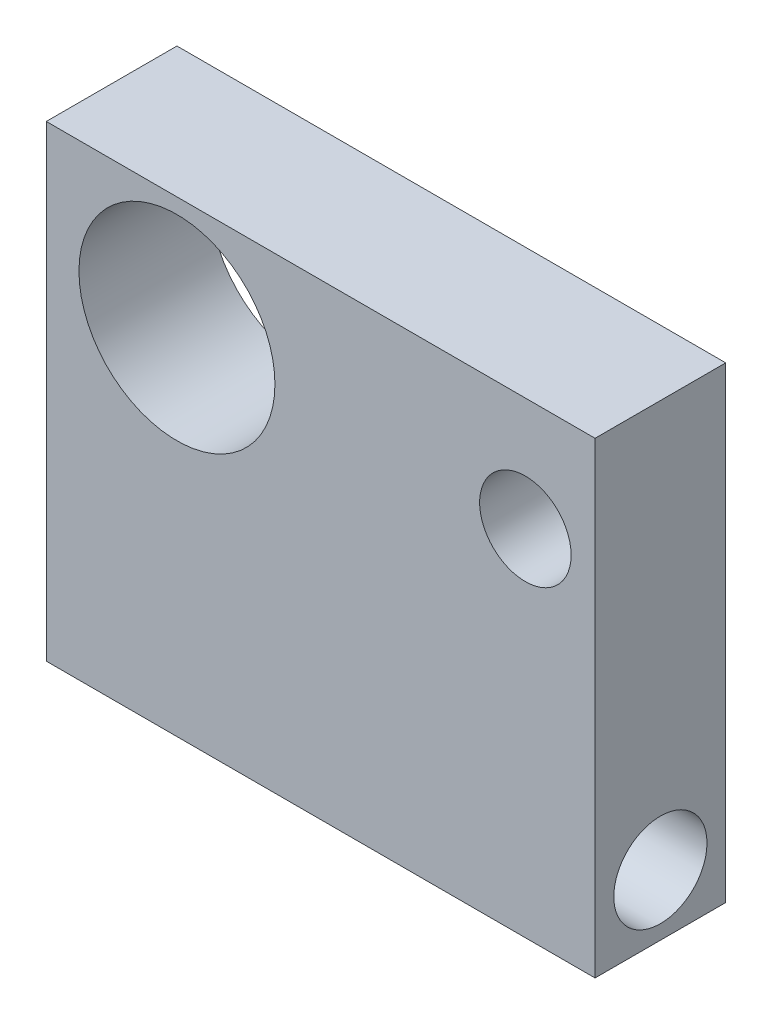
from build123d import *

# Parameters (mm, degrees)
SKETCH2_W           = 63
SKETCH2_H           = 53.66
SKETCH2_R           = 5.25
SKETCH2_R_2         = 11.25
BOSS_EXTRUDE1_DEPTH = 15
SKETCH3_R           = 5.35
CUT_EXTRUDE1_DEPTH  = 20
HOLE2_D             = 8.5


with BuildPart() as part:
    # Sketch2 → Boss-Extrude1 (new body)
    with BuildSketch(Plane.XY):
        with Locations((-0.443782019, -0.377989574)):
            Rectangle(SKETCH2_W, SKETCH2_H)
        with Locations((23.056217981, 13.452010426)):
            Circle(SKETCH2_R, mode=Mode.SUBTRACT)
        with Locations((-16.943782019, 13.452010426)):
            Circle(SKETCH2_R_2, mode=Mode.SUBTRACT)
    extrude(amount=BOSS_EXTRUDE1_DEPTH)

    # Sketch3 → Cut-Extrude1 (cut)
    with BuildSketch(Plane(origin=(31.056217981, 0, 0), x_dir=(0, 0, -1), z_dir=(1, 0, 0))):
        with Locations((-7.5, -20.207989574)):
            Circle(SKETCH3_R)
    extrude(amount=-CUT_EXTRUDE1_DEPTH, mode=Mode.SUBTRACT)

    # Hole2 (through all)
    with Locations(Plane(origin=(11.056217981, 0, 0), x_dir=(0, 0, -1), z_dir=(1, 0, 0))):
        with Locations((-7.5, -20.207989574)):
            Hole(HOLE2_D / 2)


solid = part.part
